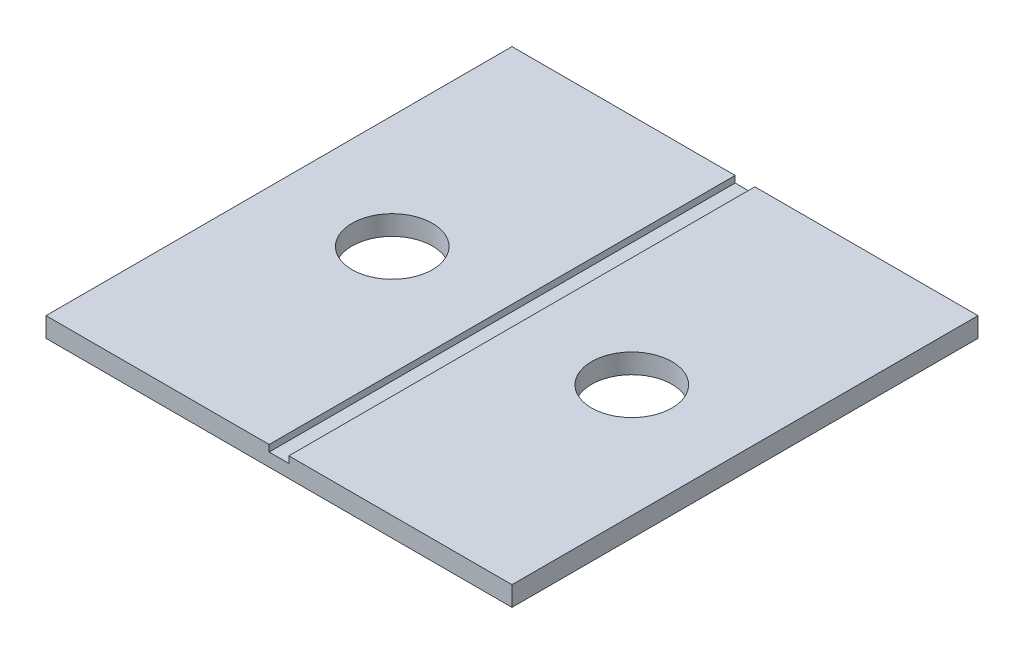
from build123d import *

# Parameters (mm, degrees)
PANEL_W                         = 284
PANEL_H                         = 284
PANEL_R                         = 24.5
PANEL_PLY_DEPTH                 = 12
SKETCH2_W                       = 12
SKETCH2_H                       = 284
CENTER_BRANCE_HOUSING_CUT_DEPTH = 4


with BuildPart() as part:
    # Panel → Panel Ply (new body)
    with BuildSketch(Plane(origin=(0, 0, 0), x_dir=(1, 0, 0), z_dir=(0, 1, 0))):
        with Locations((142, 142)):
            Rectangle(PANEL_W, PANEL_H)
        with Locations((69, 142)):
            Circle(PANEL_R, mode=Mode.SUBTRACT)
        with Locations((215, 142)):
            Circle(PANEL_R, mode=Mode.SUBTRACT)
    extrude(amount=PANEL_PLY_DEPTH)

    # Sketch2 → Center Brance Housing Cut (cut)
    with BuildSketch(Plane(origin=(0, 12, 0), x_dir=(1, 0, 0), z_dir=(0, 1, 0))):
        with Locations((142, 142)):
            Rectangle(SKETCH2_W, SKETCH2_H)
    extrude(amount=-CENTER_BRANCE_HOUSING_CUT_DEPTH, mode=Mode.SUBTRACT)


solid = part.part
